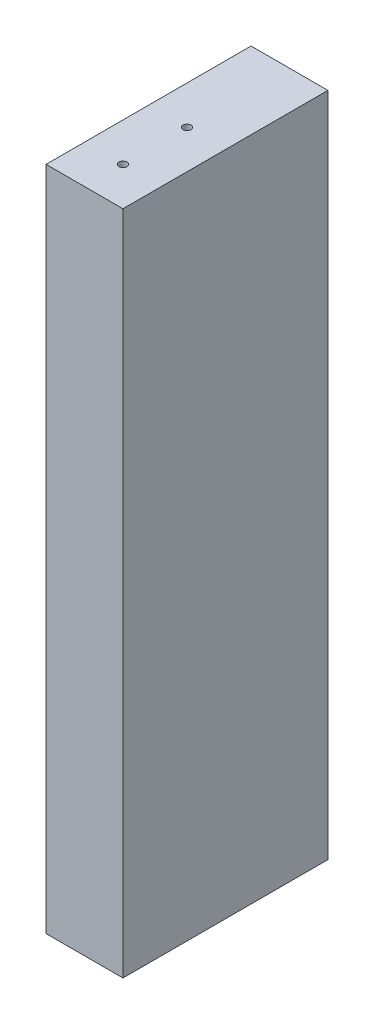
from build123d import *

# Parameters (mm, degrees)
SKETCH1_W                           = 19.05
SKETCH1_H                           = 165.099999729
BOSS_EXTRUDE1_DEPTH                 = 50.8
F_5_64_0_07813_DIAMETER_HOLE1_D     = 1.984502
F_5_64_0_07813_DIAMETER_HOLE1_DEPTH = 38.1
F_5_64_0_07813_DIAMETER_HOLE1_TIP   = 0.59620455
F_5_64_0_07813_DIAMETER_HOLE2_D     = 1.984502
F_5_64_0_07813_DIAMETER_HOLE2_DEPTH = 19.05
F_5_64_0_07813_DIAMETER_HOLE2_TIP   = 0.59620455
F_5_64_0_07813_DIAMETER_HOLE3_D     = 1.984502
F_5_64_0_07813_DIAMETER_HOLE3_DEPTH = 19.05
F_5_64_0_07813_DIAMETER_HOLE3_TIP   = 0.59620455


with BuildPart() as part:
    # Sketch1 → Boss-Extrude1 (new body)
    with BuildSketch(Plane.XY):
        with Locations((440.567640906, 6183.630000136)):
            Rectangle(SKETCH1_W, SKETCH1_H)
    extrude(amount=BOSS_EXTRUDE1_DEPTH)

    # 5/64 (0.07813) Diameter Hole1
    with Locations(Plane(origin=(4.968994719, 3.22e-07, -19.050107671), x_dir=(-1, 0, 0), z_dir=(0, 1.37705190708017e-10, -1.0))):
        with Locations((-481.589248274, 6993.254992531), (-386.339248274, 6993.254992531), (-291.089248274, 6993.254992531), (-295.274999999, 6965.135938475), (-295.274999999, 6812.735938475), (-295.274999999, 6660.335938474), (-285.166362357, 6631.468843414), (-475.477307398, 6631.468752771), (-485.002307398, 6660.335938474), (-485.002307398, 6812.735938474), (-485.002307398, 6965.135938474), (-478.365617646, 6611.6708), (-287.865617646, 6611.6708), (-307.975, 6564.3379), (-307.975, 6488.1379), (-284.960913066, 6440.805), (-380.210913066, 6440.805), (-475.460913066, 6440.805), (-446.831312422, 6488.1379), (-446.831312422, 6564.3379), (-472.231312422, 6396.355), (-472.231312422, 6320.155), (-472.653156211, 6275.705000839), (-377.403156211, 6275.705000839), (-282.153156211, 6275.705000839), (-282.575, 6320.155), (-282.575, 6396.355), (-435.598646187, 6221.729999816), (-435.598646187, 6145.529999816), (-450.592518112, 6091.554999951), (-460.998646187, 6091.555478285), (-460.998646187, 6056.629999944), (-460.998646187, 5980.429999944), (-460.998646187, 5945.505000042), (-282.153156211, 5945.505000042), (-368.611823093, 5945.505000042)):
            Hole(F_5_64_0_07813_DIAMETER_HOLE1_D / 2, depth=F_5_64_0_07813_DIAMETER_HOLE1_DEPTH)
            with Locations((0, 0, -(F_5_64_0_07813_DIAMETER_HOLE1_DEPTH + F_5_64_0_07813_DIAMETER_HOLE1_TIP / 2))):  # 118° drill point
                Cone(0, F_5_64_0_07813_DIAMETER_HOLE1_D / 2, F_5_64_0_07813_DIAMETER_HOLE1_TIP, mode=Mode.SUBTRACT)

    # 5/64 (0.07813) Diameter Hole2
    with Locations(Plane(origin=(0, 6101.080000271, 0), x_dir=(-1, 0, 0), z_dir=(0, -1, 0))):
        with Locations((-440.567640906, -41.274984774), (-440.567640906, -25.399984774)):
            Hole(F_5_64_0_07813_DIAMETER_HOLE2_D / 2, depth=F_5_64_0_07813_DIAMETER_HOLE2_DEPTH)
            with Locations((0, 0, -(F_5_64_0_07813_DIAMETER_HOLE2_DEPTH + F_5_64_0_07813_DIAMETER_HOLE2_TIP / 2))):  # 118° drill point
                Cone(0, F_5_64_0_07813_DIAMETER_HOLE2_D / 2, F_5_64_0_07813_DIAMETER_HOLE2_TIP, mode=Mode.SUBTRACT)

    # 5/64 (0.07813) Diameter Hole3
    with Locations(Plane(origin=(0, 6266.18, 0), x_dir=(1, 0, 0), z_dir=(0, 1, 0))):
        with Locations((440.567640906, -25.399984774), (440.567640906, -41.274984774)):
            Hole(F_5_64_0_07813_DIAMETER_HOLE3_D / 2, depth=F_5_64_0_07813_DIAMETER_HOLE3_DEPTH)
            with Locations((0, 0, -(F_5_64_0_07813_DIAMETER_HOLE3_DEPTH + F_5_64_0_07813_DIAMETER_HOLE3_TIP / 2))):  # 118° drill point
                Cone(0, F_5_64_0_07813_DIAMETER_HOLE3_D / 2, F_5_64_0_07813_DIAMETER_HOLE3_TIP, mode=Mode.SUBTRACT)


solid = part.part
